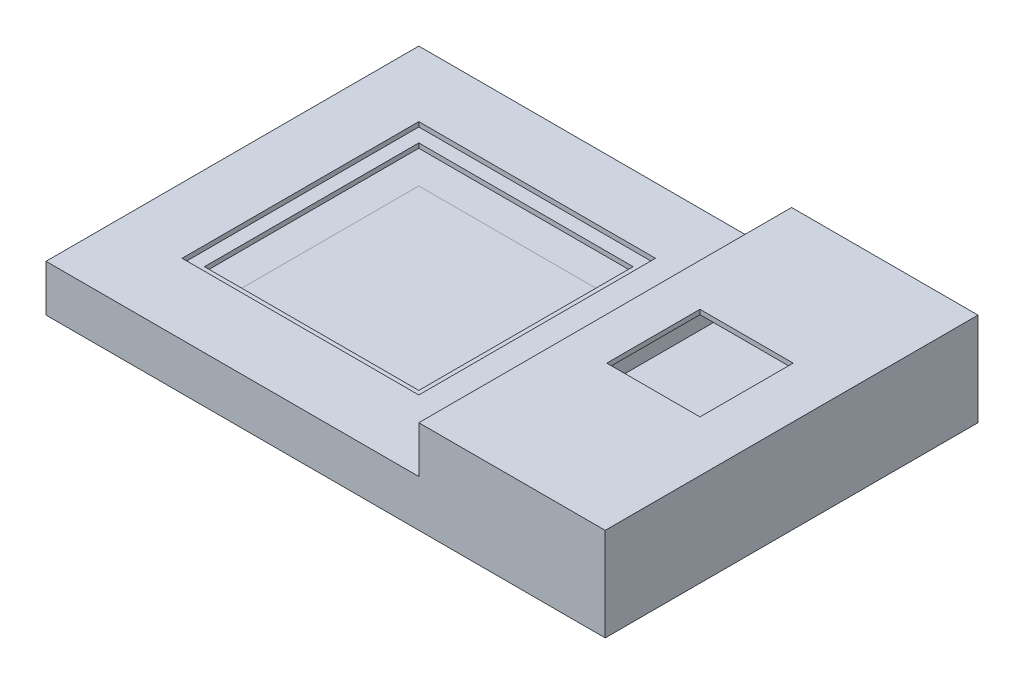
from build123d import *

# Parameters (mm, degrees)
SKETCH1_W                = 40
SKETCH1_H                = 40
SKETCH1_W_2              = 23
SKETCH1_H_2              = 23
BOSS_EXTRUDE1_DEPTH      = 5
BOSS_EXTRUDE2_DEPTH      = 5
BOSS_EXTRUDE2_DEPTH_BACK = 5
SKETCH1_4_W              = 20
SKETCH1_4_H              = 40
SKETCH2_W                = 25.4
SKETCH2_H                = 25.4
CUT_EXTRUDE1_DEPTH       = 0.5
CUT_EXTRUDE2_DEPTH       = 19.5
CUT_EXTRUDE2_DEPTH_BACK  = 19.5
SKETCH3_W                = 59
SKETCH3_H                = 3.5
CUT_EXTRUDE3_DEPTH       = 19.5
CUT_EXTRUDE3_DEPTH_BACK  = 19.5
SKETCH4_W                = 10
SKETCH4_H                = 10
CUT_EXTRUDE4_DEPTH       = 2
SKETCH7_W                = 23
SKETCH7_H                = 23
BOSS_EXTRUDE3_DEPTH      = 0.5


with BuildPart() as part:
    # Sketch1 → Boss-Extrude1 (new body)
    with BuildSketch(Plane(origin=(0, 0, 0), x_dir=(1, 0, 0), z_dir=(0, 1, 0))):
        Rectangle(SKETCH1_W, SKETCH1_H)
        Rectangle(SKETCH1_W_2, SKETCH1_H_2, mode=Mode.SUBTRACT)
    extrude(amount=-BOSS_EXTRUDE1_DEPTH)

    # Sketch1<4> → Boss-Extrude2 (add, two sides: drawn at the far end of the back side and taken through both)
    with BuildSketch(Plane(origin=(0, 0, 0), x_dir=(1, 0, 0), z_dir=(0, 1, 0)).offset(-BOSS_EXTRUDE2_DEPTH_BACK)):
        with Locations((30, 0)):
            Rectangle(SKETCH1_4_W, SKETCH1_4_H)
    extrude(amount=BOSS_EXTRUDE2_DEPTH + BOSS_EXTRUDE2_DEPTH_BACK)

    # Sketch2 → Cut-Extrude1 (cut)
    with BuildSketch(Plane(origin=(0, 0, 0), x_dir=(1, 0, 0), z_dir=(0, 1, 0))):
        with Locations((-0.278388484, 0.278388484)):
            Rectangle(SKETCH2_W, SKETCH2_H)
    extrude(amount=-CUT_EXTRUDE1_DEPTH, mode=Mode.SUBTRACT)

    # Sketch3 → Cut-Extrude2 (cut, two sides: drawn at the far end of the back side and taken through both)
    with BuildSketch(Plane.XY.offset(-CUT_EXTRUDE2_DEPTH_BACK)):
        with Locations((10, -2.75)):
            Rectangle(SKETCH3_W, SKETCH3_H)
    extrude(amount=CUT_EXTRUDE2_DEPTH + CUT_EXTRUDE2_DEPTH_BACK, mode=Mode.SUBTRACT)

    # Sketch5 → Cut-Extrude3 (cut, two sides: drawn at the far end of the back side and taken through both)
    with BuildSketch(Plane.XY.offset(-CUT_EXTRUDE3_DEPTH_BACK)):
        Polygon((39.5, -4.5), (20.5, -4.5), (20, -4.5), (20, -1), (20.5, -1), (20.5, 4.5), (39.5, 4.5), align=None)
    extrude(amount=CUT_EXTRUDE3_DEPTH + CUT_EXTRUDE3_DEPTH_BACK, mode=Mode.SUBTRACT)

    # Sketch4 → Cut-Extrude4 (cut)
    with BuildSketch(Plane(origin=(0, 5, 0), x_dir=(1, 0, 0), z_dir=(0, 1, 0))):
        with Locations((29.545931586, 0.622908533)):
            Rectangle(SKETCH4_W, SKETCH4_H)
    extrude(amount=-CUT_EXTRUDE4_DEPTH, mode=Mode.SUBTRACT)


with BuildPart() as body_2:
    # Sketch7 → Boss-Extrude3 (new body)
    with BuildSketch(Plane(origin=(0, -4.5, 0), x_dir=(1, 0, 0), z_dir=(0, 1, 0))):
        Rectangle(SKETCH7_W, SKETCH7_H)
    extrude(amount=-BOSS_EXTRUDE3_DEPTH)


solid = Compound([part.part, body_2.part])
